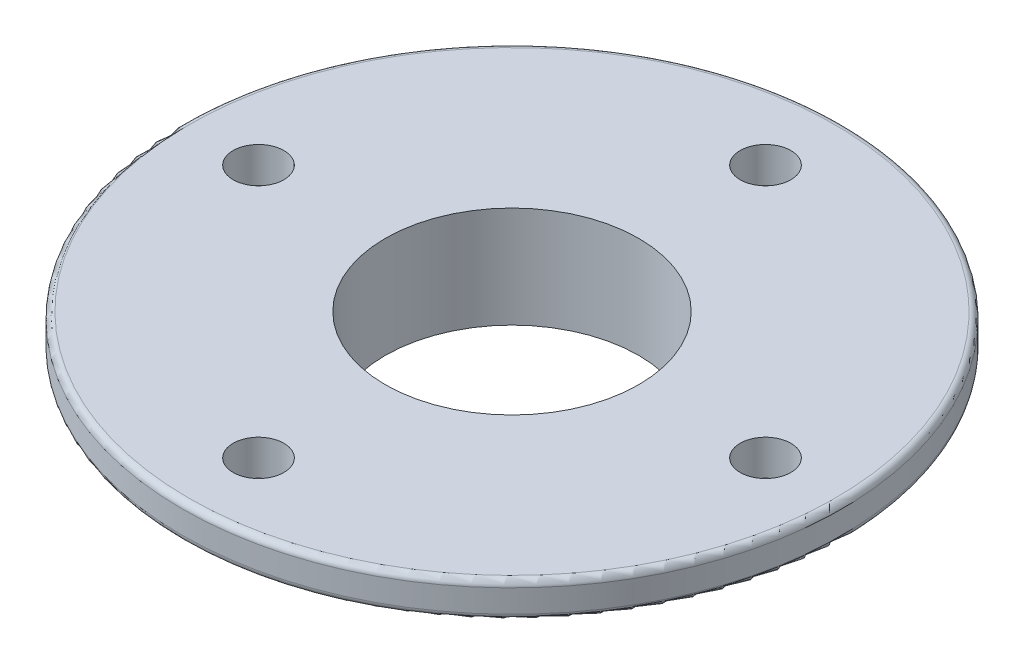
from build123d import *

# Parameters (mm, degrees)
SKETCH1_R           = 7
SKETCH1_R_2         = 5
BOSS_EXTRUDE1_DEPTH = 2.6
SKETCH2_R           = 13
SKETCH2_R_2         = 5
BOSS_EXTRUDE2_DEPTH = 1.4
SKETCH3_R           = 1
CUT_EXTRUDE1_DEPTH  = 19.814887722
CIRPATTERN1_COUNT   = 4
FILLET1_R           = 0.25


with BuildPart() as part:
    # Sketch1 → Boss-Extrude1 (new body)
    with BuildSketch(Plane(origin=(0, 0, 0), x_dir=(1, 0, 0), z_dir=(0, 1, 0))):
        Circle(SKETCH1_R)
        Circle(SKETCH1_R_2, mode=Mode.SUBTRACT)
    extrude(amount=BOSS_EXTRUDE1_DEPTH)

    # Sketch2 → Boss-Extrude2 (add)
    with BuildSketch(Plane(origin=(0, 2.6, 0), x_dir=(1, 0, 0), z_dir=(0, 1, 0))):
        Circle(SKETCH2_R)
        Circle(SKETCH2_R_2, mode=Mode.SUBTRACT)
    extrude(amount=BOSS_EXTRUDE2_DEPTH)

    # Sketch3 → Cut-Extrude1 (cut, through all)
    with BuildSketch(Plane(origin=(0, 4, 0), x_dir=(1, 0, 0), z_dir=(0, 1, 0))):
        with Locations((0, 10)):
            Circle(SKETCH3_R)
    cut_extrude1 = extrude(amount=-CUT_EXTRUDE1_DEPTH, mode=Mode.SUBTRACT)

    # CirPattern1: Cut-Extrude1 ×4 about axis
    cirpattern1_axis = Axis((0, 2.6, 0), (0, -1, 0))
    for i in range(1, CIRPATTERN1_COUNT):
        add(cut_extrude1.rotate(cirpattern1_axis, i * 360 / CIRPATTERN1_COUNT), mode=Mode.SUBTRACT)

    # Fillet1
    fillet1_edges = [part.edges().sort_by_distance(p)[0] for p in [
        (-13, 4, 0),
        (-13, 2.6, 0),
    ]]
    fillet(fillet1_edges, radius=FILLET1_R)


solid = part.part
